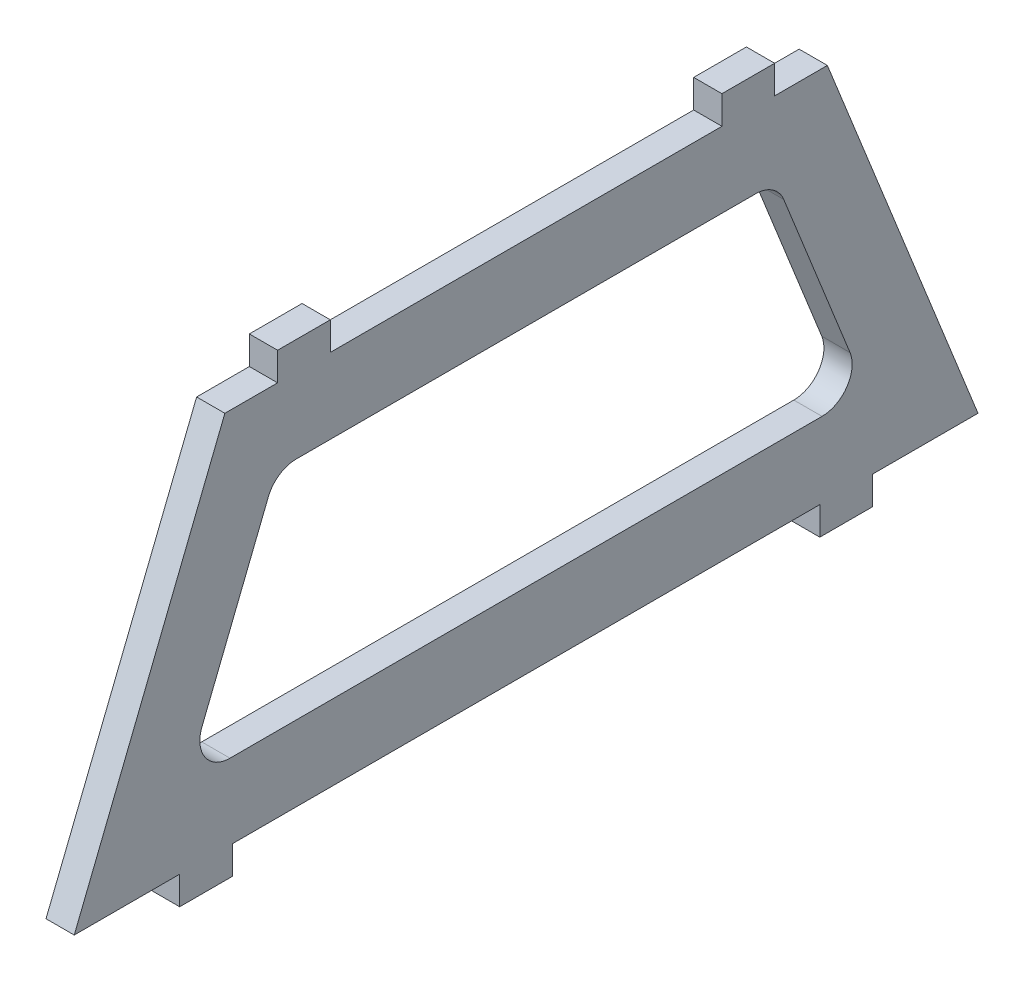
from build123d import *

# Parameters (mm, degrees)
BOSS_EXTRUDE1_DEPTH = 4.7625
CUT_EXTRUDE1_DEPTH  = 4.7625
FILLET1_R           = 5.08


with BuildPart() as part:
    # Sketch1 → Boss-Extrude1 (new body)
    with BuildSketch(Plane(origin=(0, 0, 0), x_dir=(0, 0, -1), z_dir=(1, 0, 0))):
        Polygon((-92.71, 63.5), (-101.6, 63.5), (-127, 0), (-109.22, 0), (-109.22, -4.7625), (-100.33, -4.7625), (-100.33, 0), (-1.27, 0), (-1.27, -4.7625), (7.62, -4.7625), (7.62, 0), (25.4, 0), (0, 63.5), (-8.89, 63.5), (-8.89, 68.2625), (-17.78, 68.2625), (-17.78, 63.5), (-83.82, 63.5), (-83.82, 68.2625), (-92.71, 68.2625), align=None)
    extrude(amount=BOSS_EXTRUDE1_DEPTH)

    # Sketch2 → Cut-Extrude1 (cut)
    with BuildSketch(Plane(origin=(4.7625, 0, 0), x_dir=(0, 0, -1), z_dir=(1, 0, 0))):
        Polygon((-8.636, 50.8), (-93.00168139, 50.8), (-108.24168139, 12.7), (6.604, 12.7), align=None)
    extrude(amount=-CUT_EXTRUDE1_DEPTH, mode=Mode.SUBTRACT)

    # Fillet1
    fillet1_edges = [part.edges().sort_by_distance(p)[0] for p in [
        (2.38125, 12.7, 108.24168139),
        (2.38125, 12.7, -6.604),
        (2.38125, 50.8, 8.636),
        (2.38125, 50.8, 93.00168139),
    ]]
    fillet(fillet1_edges, radius=FILLET1_R)


solid = part.part
